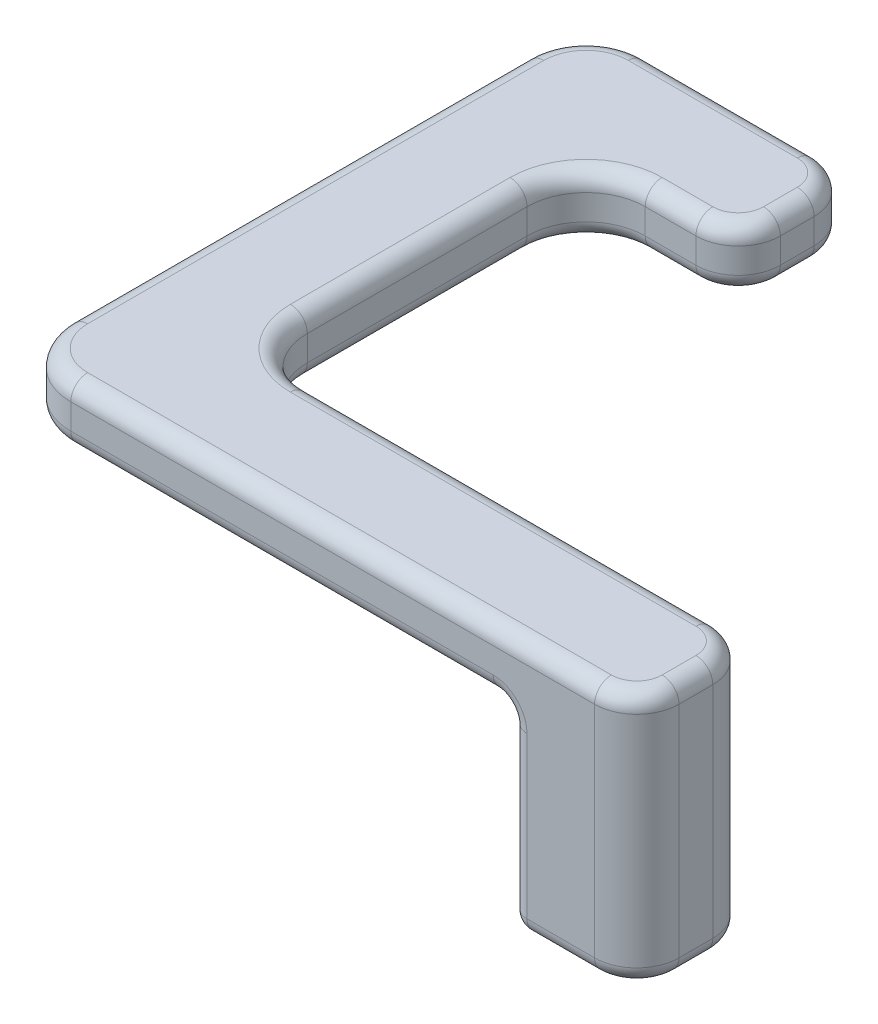
from build123d import *

# Parameters (mm, degrees)
EXTRUDE_THIN1_DEPTH = 15
FILLET1_R           = 2.5
FILLET2_R           = 3.5
SKETCH2_W           = 45
SKETCH2_H           = 56
CUT_EXTRUDE1_DEPTH  = 11.5
FILLET3_R           = 1
SKETCH3_R           = 2.25
CUT_EXTRUDE2_DEPTH  = 2.55


with BuildPart() as part:
    # Sketch1 → Extrude-Thin1 (new body)
    with BuildSketch(Plane(origin=(0, 0, 0), x_dir=(1, 0, 0), z_dir=(0, 1, 0))):
        Polygon((30, 0), (0, 0), (0, 20), (9, 20), (9, 27), (-7, 27), (-7, -7), (30, -7), align=None)
    extrude(amount=EXTRUDE_THIN1_DEPTH)

    # Fillet1
    fillet1_edges = [part.edges().sort_by_distance(p)[0] for p in [
        (30, 7.5, 7),
        (30, 7.5, 0),
        (9, 7.5, -20),
        (9, 7.5, -27),
    ]]
    fillet(fillet1_edges, radius=FILLET1_R)

    # Fillet2
    fillet2_edges = [part.edges().sort_by_distance(p)[0] for p in [
        (0, 7.5, 0),
        (-7, 7.5, 7),
        (-7, 7.5, -27),
        (0, 7.5, -20),
    ]]
    fillet(fillet2_edges, radius=FILLET2_R)

    # Sketch2 → Cut-Extrude1 (cut)
    with BuildSketch(Plane.XZ):
        Rectangle(SKETCH2_W, SKETCH2_H)
    extrude(amount=-CUT_EXTRUDE1_DEPTH, mode=Mode.SUBTRACT)

    # Fillet3
    fillet3_edges = [part.edges().sort_by_distance(p)[0] for p in [
        (22.5, 5.75, 7),
        (9.5, 11.5, 7),
        (-5.974873734, 11.5, 5.974873734),
        (-7, 11.5, -10),
        (-5.974873734, 11.5, -25.974873734),
        (1.5, 11.5, -27),
        (8.267766953, 11.5, -26.267766953),
        (8.267766953, 11.5, -20.732233047),
        (5, 11.5, -20),
        (1.025126266, 11.5, -18.974873734),
        (0, 11.5, -10),
        (1.025126266, 11.5, -1.025126266),
        (13, 11.5, 0),
        (5, 15, -20),
        (1.025126266, 15, -18.974873734),
        (0, 15, -10),
        (1.025126266, 15, -1.025126266),
        (15.5, 15, 0),
        (29.267766953, 15, 0.732233047),
        (29.267766953, 15, 6.267766953),
        (12, 15, 7),
        (-5.974873734, 15, 5.974873734),
        (-7, 15, -10),
        (-5.974873734, 15, -25.974873734),
        (1.5, 15, -27),
        (8.267766953, 15, -26.267766953),
        (25, 0, 7),
        (29.267766953, 0, 6.267766953),
        (29.267766953, 0, 0.732233047),
        (25, 0, 0),
        (22.5, 0, 3.5),
        (8.267766953, 15, -20.732233047),
        (22.5, 5.75, 0),
        (22.5, 11.5, 3.5),
        (9, 11.5, -23.5),
        (30, 15, 3.5),
        (9, 15, -23.5),
        (30, 0, 3.5),
    ]]
    fillet(fillet3_edges, radius=FILLET3_R)

    # Sketch3 → Cut-Extrude2 (cut)
    with BuildSketch(Plane.XZ):
        with Locations((26.062246628, 3.5)):
            Circle(SKETCH3_R)
    extrude(amount=-CUT_EXTRUDE2_DEPTH, mode=Mode.SUBTRACT)


solid = part.part
